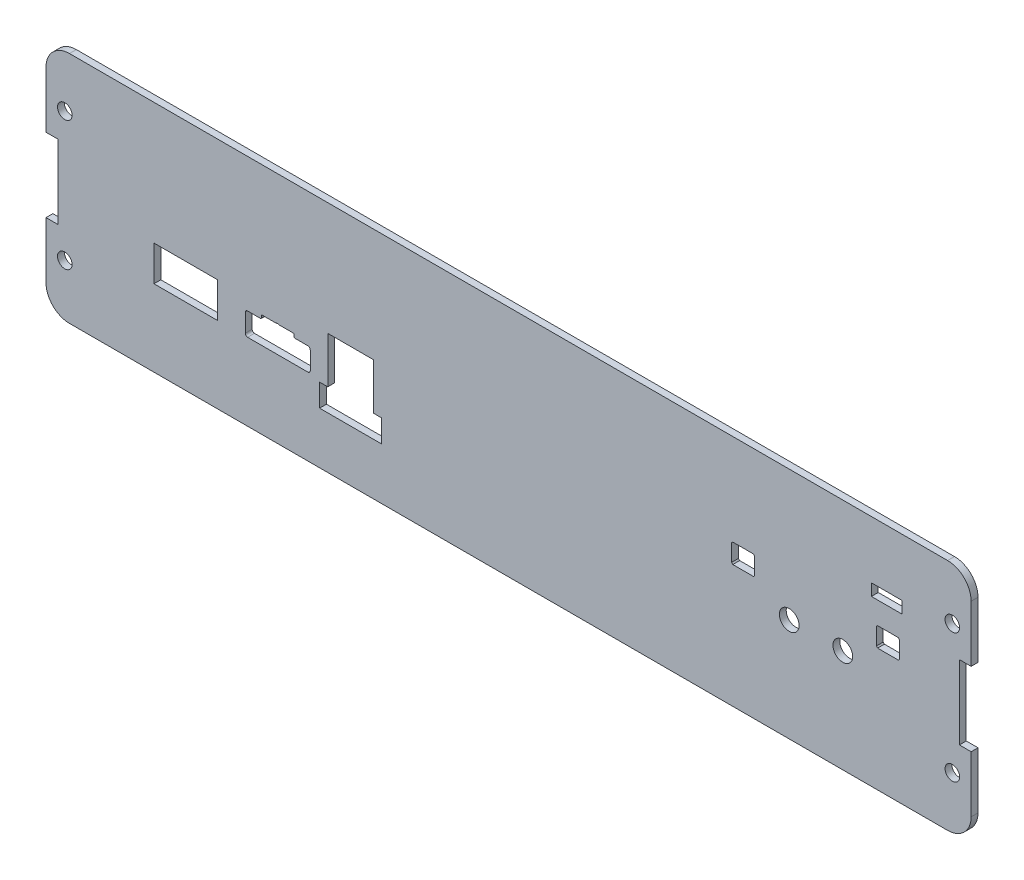
from build123d import *

# Parameters (mm, degrees)
MAINBODY_DEPTH    = 1.8542
SKETCH3_R         = 1.9685
MOUNTHOLES_DEPTH  = 129.907885308
PANELCUTOUT_REACH = 130.908
SKETCH4_R         = 2.667
SKETCH4_W         = 8.280035503
SKETCH4_H         = 3.193371256


with BuildPart() as part:
    # Sketch2 → MainBody (new body)
    with BuildSketch(Plane.XY):
        with BuildLine():
            Line((118.618, 31.5722), (-118.618, 31.5722))
            ThreePointArc((-118.618, 31.5722), (-123.108128061, 29.712328061), (-124.968, 25.2222))
            Line((-124.968, 25.2222), (-124.968, 9.9822))
            Line((-124.968, 9.9822), (-121.793, 9.9822))
            Line((-121.793, 9.9822), (-121.793, -9.9822))
            Line((-121.793, -9.9822), (-124.968, -9.9822))
            Line((-124.968, -9.9822), (-124.968, -25.2222))
            ThreePointArc((-124.968, -25.2222), (-123.108128061, -29.712328061), (-118.618, -31.5722))
            Line((-118.618, -31.5722), (118.618, -31.5722))
            ThreePointArc((118.618, -31.5722), (123.108128061, -29.712328061), (124.968, -25.2222))
            Line((124.968, -25.2222), (124.968, -9.9822))
            Line((124.968, -9.9822), (121.793, -9.9822))
            Line((121.793, -9.9822), (121.793, 9.9822))
            Line((121.793, 9.9822), (124.968, 9.9822))
            Line((124.968, 9.9822), (124.968, 25.2222))
            ThreePointArc((124.968, 25.2222), (123.108128061, 29.712328061), (118.618, 31.5722))
        make_face()
    extrude(amount=MAINBODY_DEPTH)

    # Sketch3 → MountHoles (cut, through all)
    with BuildSketch(Plane.XY.offset(1.8542)):
        with Locations((-119.888, 17.4625)):
            Circle(SKETCH3_R)
        with Locations((119.888, 17.4625)):
            Circle(SKETCH3_R)
        with Locations((119.888, -17.4625)):
            Circle(SKETCH3_R)
        with Locations((-119.888, -17.4625)):
            Circle(SKETCH3_R)
    extrude(amount=-MOUNTHOLES_DEPTH, mode=Mode.SUBTRACT)

    # Sketch4 → PanelCutout (cut, up to next)
    with BuildSketch(Plane.XY.offset(1.8542), mode=Mode.PRIVATE) as panelcutout_sk1:
        with Locations((90.297, -3.729450093)):
            Circle(SKETCH4_R)
    panelcutout_tool1 = extrude(panelcutout_sk1.sketch, amount=-PANELCUTOUT_REACH, mode=Mode.PRIVATE) & part.part
    # Sketch4 → PanelCutout (cut, up to next)
    with BuildSketch(Plane.XY.offset(1.8542), mode=Mode.PRIVATE) as panelcutout_sk2:
        with Locations((75.819, -3.729450093)):
            Circle(SKETCH4_R)
    panelcutout_tool2 = extrude(panelcutout_sk2.sketch, amount=-PANELCUTOUT_REACH, mode=Mode.PRIVATE) & part.part
    # Sketch4 → PanelCutout (cut, up to next)
    with BuildSketch(Plane.XY.offset(1.8542), mode=Mode.PRIVATE) as panelcutout_sk3:
        with Locations((102.1588002, 14.470550015)):
            Rectangle(SKETCH4_W, SKETCH4_H)
    panelcutout_tool3 = extrude(panelcutout_sk3.sketch, amount=-PANELCUTOUT_REACH, mode=Mode.PRIVATE) & part.part
    # Sketch4 → PanelCutout (cut, up to next)
    with BuildSketch(Plane.XY.offset(1.8542), mode=Mode.PRIVATE) as panelcutout_sk4:
        Polygon((-78.686925787, -10.88145), (-78.686925787, -1.35645), (-87.245740794, -1.35645), (-95.8066, -1.35645), (-95.8066, -10.88145), (-87.245740794, -10.88145), align=None)
    panelcutout_tool4 = extrude(panelcutout_sk4.sketch, amount=-PANELCUTOUT_REACH, mode=Mode.PRIVATE) & part.part
    # Sketch4 → PanelCutout (cut, up to next)
    with BuildSketch(Plane.XY.offset(1.8542), mode=Mode.PRIVATE) as panelcutout_sk5:
        with BuildLine():
            Line((-71.1318, -5.22745), (-71.1318, -10.12745))
            ThreePointArc((-71.1318, -10.12745), (-70.948155952, -10.570805952), (-70.5048, -10.75445))
            Line((-70.5048, -10.75445), (-54.2048, -10.75445))
            ThreePointArc((-54.2048, -10.75445), (-53.761444048, -10.570805952), (-53.5778, -10.12745))
            Line((-53.5778, -10.12745), (-53.5778, -5.22745))
            ThreePointArc((-53.5778, -5.22745), (-53.761444048, -4.784094048), (-54.2048, -4.60045))
            Line((-54.2048, -4.60045), (-57.6548, -4.60045))
            ThreePointArc((-57.6548, -4.60045), (-57.918550829, -4.491200829), (-58.0278, -4.22745))
            Line((-58.0278, -4.22745), (-58.0278, -3.60045))
            Line((-58.0278, -3.60045), (-62.0278, -3.60045))
            Line((-62.0278, -3.60045), (-62.0278, -3.50045))
            Line((-62.0278, -3.50045), (-62.354800024, -3.50045))
            Line((-62.354800024, -3.50045), (-62.6818, -3.50045))
            Line((-62.6818, -3.50045), (-62.6818, -3.60045))
            Line((-62.6818, -3.60045), (-66.6818, -3.60045))
            Line((-66.6818, -3.60045), (-66.6818, -4.22745))
            ThreePointArc((-66.6818, -4.22745), (-66.791049171, -4.491200829), (-67.0548, -4.60045))
            Line((-67.0548, -4.60045), (-70.5048, -4.60045))
            ThreePointArc((-70.5048, -4.60045), (-70.948155952, -4.784094048), (-71.1318, -5.22745))
        make_face()
    panelcutout_tool5 = extrude(panelcutout_sk5.sketch, amount=-PANELCUTOUT_REACH, mode=Mode.PRIVATE) & part.part
    # Sketch4 → PanelCutout (cut, up to next)
    with BuildSketch(Plane.XY.offset(1.8542), mode=Mode.PRIVATE) as panelcutout_sk6:
        Polygon((-36.551791576, -11.51645), (-36.551791576, 0.99955), (-48.841754151, 0.99955), (-48.841754151, -11.51645), (-51.0518, -11.51645), (-51.0518, -17.61245), (-34.2878, -17.61245), (-34.2878, -11.51645), align=None)
    panelcutout_tool6 = extrude(panelcutout_sk6.sketch, amount=-PANELCUTOUT_REACH, mode=Mode.PRIVATE) & part.part
    # Sketch4 → PanelCutout (cut, up to next)
    with BuildSketch(Plane.XY.offset(1.8542), mode=Mode.PRIVATE) as panelcutout_sk7:
        Polygon((60.2488, 6.547255322), (60.2488, 1.946245078), (60.577194878, 1.6178502), (66.168805122, 1.6178502), (66.4972, 1.946245078), (66.4972, 6.547255322), (66.168805122, 6.8756502), (60.577194878, 6.8756502), align=None)
    panelcutout_tool7 = extrude(panelcutout_sk7.sketch, amount=-PANELCUTOUT_REACH, mode=Mode.PRIVATE) & part.part
    # Sketch4 → PanelCutout (cut, up to next)
    with BuildSketch(Plane.XY.offset(1.8542), mode=Mode.PRIVATE) as panelcutout_sk8:
        Polygon((99.3648, 6.547255322), (99.3648, 1.946245078), (99.693194878, 1.6178502), (105.284805122, 1.6178502), (105.6132, 1.946245078), (105.6132, 6.547255322), (105.284805122, 6.8756502), (99.693194878, 6.8756502), align=None)
    panelcutout_tool8 = extrude(panelcutout_sk8.sketch, amount=-PANELCUTOUT_REACH, mode=Mode.PRIVATE) & part.part
    add(panelcutout_tool1.solids().sort_by_distance((90.297, -3.72945, 1.8542))[0], mode=Mode.SUBTRACT)
    add(panelcutout_tool2.solids().sort_by_distance((75.819, -3.72945, 1.8542))[0], mode=Mode.SUBTRACT)
    add(panelcutout_tool3.solids().sort_by_distance((102.1588, 14.47055, 1.8542))[0], mode=Mode.SUBTRACT)
    add(panelcutout_tool4.solids().sort_by_distance((-87.246763, -6.11895, 1.8542))[0], mode=Mode.SUBTRACT)
    add(panelcutout_tool5.solids().sort_by_distance((-62.3548, -7.40773, 1.8542))[0], mode=Mode.SUBTRACT)
    add(panelcutout_tool6.solids().sort_by_distance((-42.686006, -8.973127, 1.8542))[0], mode=Mode.SUBTRACT)
    add(panelcutout_tool7.solids().sort_by_distance((63.373, 4.24675, 1.8542))[0], mode=Mode.SUBTRACT)
    add(panelcutout_tool8.solids().sort_by_distance((102.489, 4.24675, 1.8542))[0], mode=Mode.SUBTRACT)


solid = part.part
